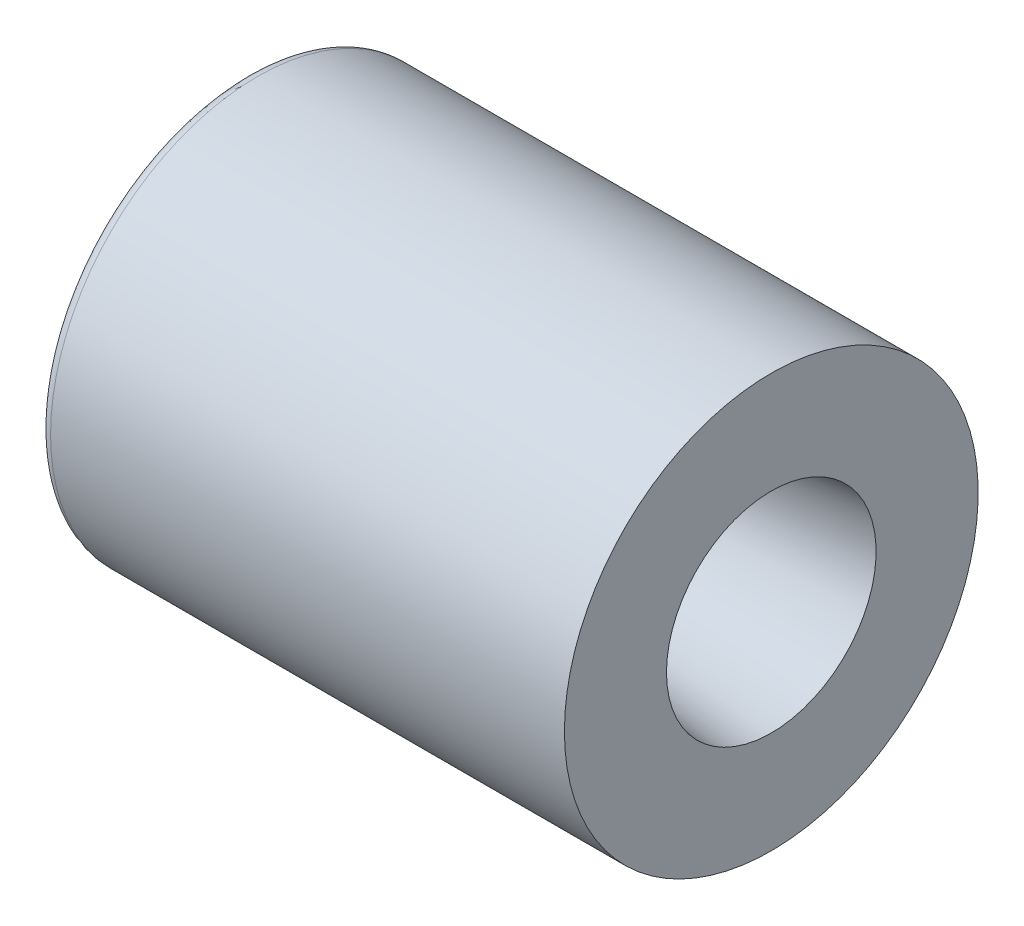
from build123d import *

# Parameters (mm, degrees)
FILLET1_R = 0.508


with BuildPart() as part:
    # Sketch1 → Revolve1 (revolve)
    with BuildSketch(Plane(origin=(0, 0, 0), x_dir=(1, 0, 0), z_dir=(0, 1, 0))):
        Polygon((0, 2.286), (0, 5.3848), (1.905, 5.3848), (1.905, 8.001), (0, 8.001), (0, 9.525), (24.166485714, 9.525), (24.166485714, 4.826), align=None)
    revolve(axis=Axis((0, 0, 0), (1, 0, 0)))

    # Fillet1
    fillet1_edges = [part.edges().sort_by_distance(p)[0] for p in [
        (0, 0, 9.525),
    ]]
    fillet(fillet1_edges, radius=FILLET1_R)


solid = part.part
